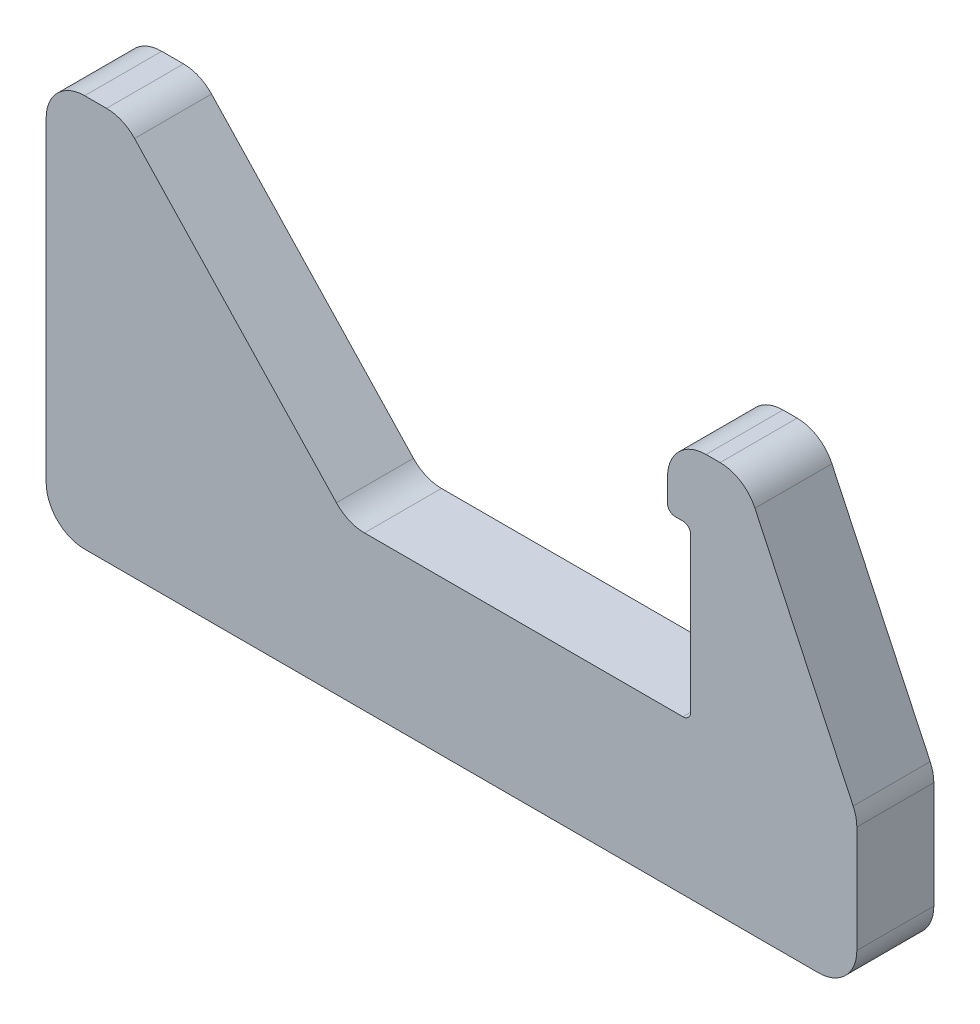
from build123d import *

# Parameters (mm, degrees)
BOSS_EXTRUDE1_DEPTH = 10
FILLET1_R           = 5
FILLET2_R           = 1


with BuildPart() as part:
    # Sketch1 → Boss-Extrude1 (new body)
    with BuildSketch(Plane.XY):
        Polygon((-105.272608391, 0), (-105.272608391, 51), (-95.272608391, 51), (-66.101550955, 20), (-21.583146337, 20), (-21.583146337, 42), (-24.583146337, 42), (-24.583146337, 51), (-14.583146337, 51), (0, 20), (0, 0), align=None)
    extrude(amount=BOSS_EXTRUDE1_DEPTH)

    # Fillet1
    fillet1_edges = [part.edges().sort_by_distance(p)[0] for p in [
        (0, 0, 5),
        (-105.272608391, 0, 5),
        (-105.272608391, 51, 5),
        (-95.272608391, 51, 5),
        (-66.101550955, 20, 5),
        (0, 20, 5),
        (-14.583146337, 51, 5),
        (-24.583146337, 51, 5),
    ]]
    fillet(fillet1_edges, radius=FILLET1_R)

    # Fillet2
    fillet2_edges = [part.edges().sort_by_distance(p)[0] for p in [
        (-21.583146337, 20, 5),
        (-21.583146337, 42, 5),
        (-24.583146337, 42, 5),
    ]]
    fillet(fillet2_edges, radius=FILLET2_R)


solid = part.part
